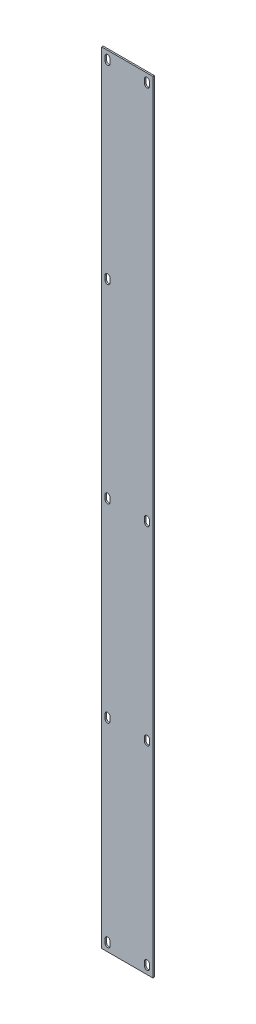
from build123d import *

# Parameters (mm, degrees)
SKETCH1_W                  = 27.7
SKETCH1_H                  = 0.8128
BOSS_EXTRUDE1_DEPTH        = 422.91
M2_5_START                 = -0.4064
M2_5_CLEARANCE_SLOT2_DEPTH = 0.8128


# Read off the part's stored shape, not the designer's step: M2.5 Clearance Slot2
with BuildPart() as part:
    # Sketch1 → Boss-Extrude1 (new body)
    with BuildSketch(Plane(origin=(0, 0, 0), x_dir=(1, 0, 0), z_dir=(0, 1, 0))):
        Rectangle(SKETCH1_W, SKETCH1_H)
    extrude(amount=BOSS_EXTRUDE1_DEPTH)

    # M2.5 Clearance Slot2 outline → M2.5 Clearance Slot2 (cut)
    with BuildSketch(Plane.XY.offset(M2_5_START)):
        with BuildLine():
            ThreePointArc((-9.325, 111.0025), (-10.675, 112.3525), (-12.025, 111.0025))
            Line((-12.025, 111.0025), (-12.025, 108.7025))
            ThreePointArc((-12.025, 108.7025), (-10.675, 107.3525), (-9.325, 108.7025))
            Line((-9.325, 108.7025), (-9.325, 111.0025))
        make_face()
        with BuildLine():
            Line((-9.325, 211.555), (-9.325, 213.855))
            ThreePointArc((-9.325, 213.855), (-10.675, 215.205), (-12.025, 213.855))
            Line((-12.025, 213.855), (-12.025, 211.555))
            ThreePointArc((-12.025, 211.555), (-10.675, 210.205), (-9.325, 211.555))
        make_face()
        with BuildLine():
            Line((-9.325, 314.4075), (-9.325, 316.7075))
            ThreePointArc((-9.325, 316.7075), (-10.675, 318.0575), (-12.025, 316.7075))
            Line((-12.025, 316.7075), (-12.025, 314.4075))
            ThreePointArc((-12.025, 314.4075), (-10.675, 313.0575), (-9.325, 314.4075))
        make_face()
        with BuildLine():
            Line((-9.325, 417.26), (-9.325, 419.56))
            ThreePointArc((-9.325, 419.56), (-10.675, 420.91), (-12.025, 419.56))
            Line((-12.025, 419.56), (-12.025, 417.26))
            ThreePointArc((-12.025, 417.26), (-10.675, 415.91), (-9.325, 417.26))
        make_face()
        with BuildLine():
            Line((-9.325, 3.35), (-9.325, 5.65))
            ThreePointArc((-9.325, 5.65), (-10.675, 7), (-12.025, 5.65))
            Line((-12.025, 5.65), (-12.025, 3.35))
            ThreePointArc((-12.025, 3.35), (-10.675, 2), (-9.325, 3.35))
        make_face()
        with BuildLine():
            ThreePointArc((12.025, 111.0025), (10.675, 112.3525), (9.325, 111.0025))
            Line((9.325, 111.0025), (9.325, 108.7025))
            ThreePointArc((9.325, 108.7025), (10.675, 107.3525), (12.025, 108.7025))
            Line((12.025, 108.7025), (12.025, 111.0025))
        make_face()
        with BuildLine():
            Line((12.025, 211.555), (12.025, 213.855))
            ThreePointArc((12.025, 213.855), (10.675, 215.205), (9.325, 213.855))
            Line((9.325, 213.855), (9.325, 211.555))
            ThreePointArc((9.325, 211.555), (10.675, 210.205), (12.025, 211.555))
        make_face()
        with BuildLine():
            Line((12.025, 417.26), (12.025, 419.56))
            ThreePointArc((12.025, 419.56), (10.675, 420.91), (9.325, 419.56))
            Line((9.325, 419.56), (9.325, 417.26))
            ThreePointArc((9.325, 417.26), (10.675, 415.91), (12.025, 417.26))
        make_face()
        with BuildLine():
            Line((12.025, 3.35), (12.025, 5.65))
            ThreePointArc((12.025, 5.65), (10.675, 7), (9.325, 5.65))
            Line((9.325, 5.65), (9.325, 3.35))
            ThreePointArc((9.325, 3.35), (10.675, 2), (12.025, 3.35))
        make_face()
    extrude(amount=M2_5_CLEARANCE_SLOT2_DEPTH, mode=Mode.SUBTRACT)


solid = part.part
